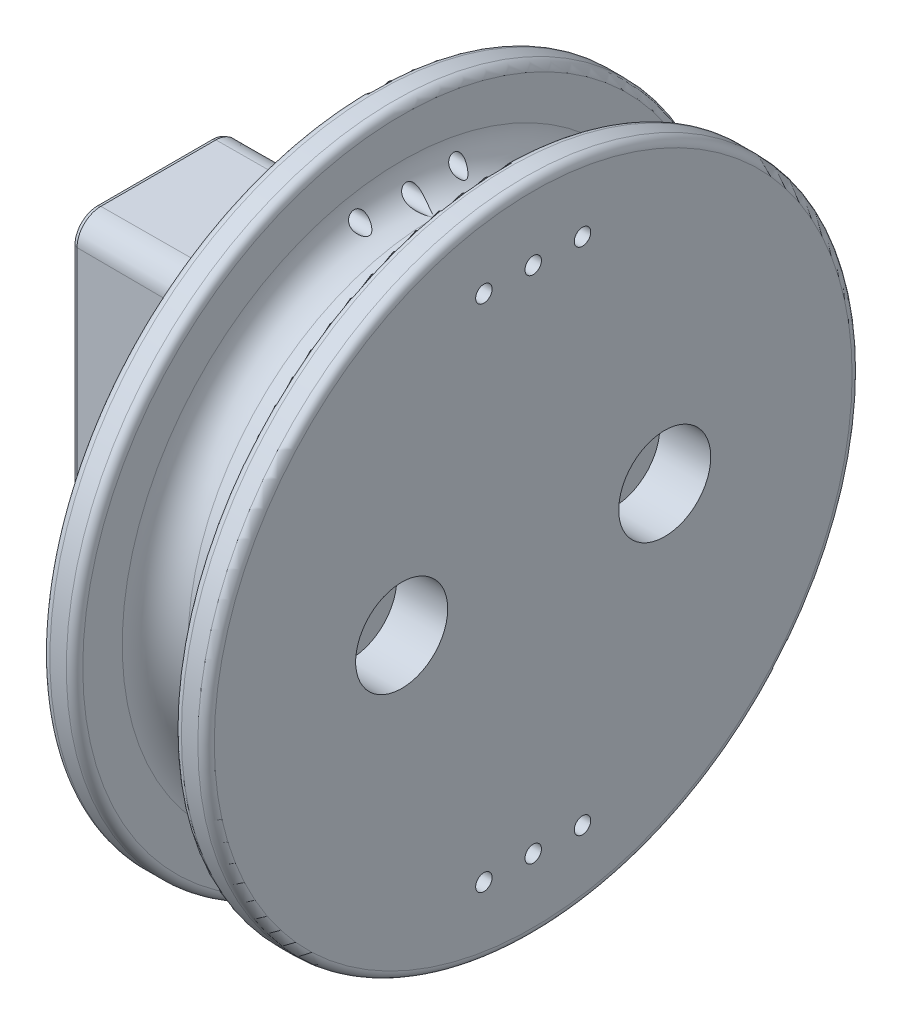
from build123d import *
from OCP.BRepFilletAPI import BRepFilletAPI_MakeChamfer

# Parameters (mm, degrees)
SKIZZE1_R                                            = 11.5
AUFSATZ_LINEAR_AUSTRAGEN1_DEPTH                      = 13
AUFSATZ_LINEAR_AUSTRAGEN2_DEPTH                      = 10
AUFSATZ_LINEAR_AUSTRAGEN2_DRAFT                      = -0.3
STIRNSENKUNG_F_R_M3_ZYLINDERSCHRAUBE_MIT_D           = 3.1
STIRNSENKUNG_F_R_M3_ZYLINDERSCHRAUBE_MIT_CBORE_D     = 5.6
STIRNSENKUNG_F_R_M3_ZYLINDERSCHRAUBE_MIT_CBORE_DEPTH = 3.1
SKIZZE6_R                                            = 19.9
SKIZZE6_R_2                                          = 11.5
AUFSATZ_LINEAR_AUSTRAGEN3_DEPTH                      = 10
VERRUNDUNG1_R                                        = 1
FASE2_SIZE                                           = 0.2
FASE2_SIZE2                                          = 0.07293404
SKIZZE8_W                                            = 6
SKIZZE8_H                                            = 4.9
VERRUNDUNG2_R                                        = 2
VERRUNDUNG3_R                                        = 0.5
VERRUNDUNG4_R                                        = 2
SCHNITT_LINEAR_START                                 = -10
SKIZZE10_R                                           = 0.5
SCHNITT_LINEAR_AUSTRAGEN4_DEPTH                      = 44.406885637


with BuildPart() as part:
    # Skizze1 → Aufsatz-Linear austragen1 (new body)
    with BuildSketch(Plane(origin=(0, 0, 0), x_dir=(0, 0, -1), z_dir=(1, 0, 0))):
        Circle(SKIZZE1_R)
    extrude(amount=AUFSATZ_LINEAR_AUSTRAGEN1_DEPTH)


with BuildPart() as aufsatz_linear_austragen2_tool:
    # Skizze2 → Aufsatz-Linear austragen2 (with draft: the straight prism first)
    with BuildSketch(Plane(origin=(0, 0, 0), x_dir=(0, 0, -1), z_dir=(1, 0, 0))):
        with BuildLine():
            Line((5, -7.5), (5, 7.5))
            ThreePointArc((5, 7.5), (4.560660172, 8.560660172), (3.5, 9))
            Line((3.5, 9), (-3.5, 9))
            ThreePointArc((-3.5, 9), (-4.560660172, 8.560660172), (-5, 7.5))
            Line((-5, 7.5), (-5, -7.5))
            ThreePointArc((-5, -7.5), (-4.560660172, -8.560660172), (-3.5, -9))
            Line((-3.5, -9), (3.5, -9))
            ThreePointArc((3.5, -9), (4.560660172, -8.560660172), (5, -7.5))
        make_face()
    extrude(amount=-AUFSATZ_LINEAR_AUSTRAGEN2_DEPTH)
    # Aufsatz-Linear austragen2: the draft: its side faces are tilted about the plane it starts from
    aufsatz_linear_austragen2_sides = [aufsatz_linear_austragen2_tool.faces().sort_by_distance(p)[0] for p in [
        (-5, 0, -5),
        (-5, 8.560660172, -4.560660172),
        (-5, 9, 0),
        (-5, 8.560660172, 4.560660172),
        (-5, 0, 5),
        (-5, -8.560660172, 4.560660172),
        (-5, -9, 0),
        (-5, -8.560660172, -4.560660172),
    ]]
    draft(aufsatz_linear_austragen2_sides, Plane(origin=(0, 0, 0), x_dir=(0, 0, -1), z_dir=(1, 0, 0)), AUFSATZ_LINEAR_AUSTRAGEN2_DRAFT)


with BuildPart() as part_1:
    add(part.part)

    # Aufsatz-Linear austragen2: add aufsatz_linear_austragen2_tool
    add(aufsatz_linear_austragen2_tool.part)

    # Stirnsenkung für M3 Zylinderschraube mit Innensechskant1 (through all)
    with Locations(Plane(origin=(13, 0, 0), x_dir=(0, 0, -1), z_dir=(1, 0, 0))):
        with Locations((8, 0), (-8, 0)):
            CounterBoreHole(STIRNSENKUNG_F_R_M3_ZYLINDERSCHRAUBE_MIT_D / 2, STIRNSENKUNG_F_R_M3_ZYLINDERSCHRAUBE_MIT_CBORE_D / 2, STIRNSENKUNG_F_R_M3_ZYLINDERSCHRAUBE_MIT_CBORE_DEPTH)

    # Skizze6 → Aufsatz-Linear austragen3 (add)
    with BuildSketch(Plane(origin=(3, 0, 0), x_dir=(0, 0, -1), z_dir=(1, 0, 0))):
        Circle(SKIZZE6_R)
        Circle(SKIZZE6_R_2, mode=Mode.SUBTRACT)
    extrude(amount=AUFSATZ_LINEAR_AUSTRAGEN3_DEPTH)

    # Verrundung1
    verrundung1_edges = [part_1.edges().sort_by_distance(p)[0] for p in [
        (0, -8.560660172, 4.560660172),
        (0, 0, 5),
        (0, 8.560660172, 4.560660172),
        (0, 9, 0),
        (0, 8.560660172, -4.560660172),
        (0, 0, -5),
        (0, -8.560660172, -4.560660172),
        (0, -9, 0),
    ]]
    fillet(verrundung1_edges, radius=VERRUNDUNG1_R)

    # Fase2: one chamfer whose edges measure the first distance from different faces: ONE call of the kernel's chamfer builder (chamfer() names one face for all edges)
    fase2_edges_1 = [part_1.edges().sort_by_distance(p)[0] for p in [
        (-10, 0, 4.947639644),
    ]]
    fase2_side_1 = [part_1.faces().sort_by_distance(p)[0] for p in [
        (-5.497382018, 0, 4.971215512),
    ]]
    fase2_edges_2 = [part_1.edges().sort_by_distance(p)[0] for p in [
        (-10, -8.523635809, 4.523635809),
    ]]
    fase2_side_2 = [part_1.faces().sort_by_distance(p)[0] for p in [
        (-5.497382018, -8.540306465, 4.540306465),
    ]]
    fase2_edges_3 = [part_1.edges().sort_by_distance(p)[0] for p in [
        (-10, 8.523635809, 4.523635809),
    ]]
    fase2_side_3 = [part_1.faces().sort_by_distance(p)[0] for p in [
        (-5.497382018, 8.540306465, 4.540306465),
    ]]
    fase2_edges_4 = [part_1.edges().sort_by_distance(p)[0] for p in [
        (-10, -8.947639644, 0),
    ]]
    fase2_side_4 = [part_1.faces().sort_by_distance(p)[0] for p in [
        (-5.497382018, -8.971215512, 0),
    ]]
    fase2_edges_5 = [part_1.edges().sort_by_distance(p)[0] for p in [
        (-10, 8.947639644, 0),
    ]]
    fase2_side_5 = [part_1.faces().sort_by_distance(p)[0] for p in [
        (-5.497382018, 8.971215512, 0),
    ]]
    fase2_edges_6 = [part_1.edges().sort_by_distance(p)[0] for p in [
        (-10, -8.523635809, -4.523635809),
    ]]
    fase2_side_6 = [part_1.faces().sort_by_distance(p)[0] for p in [
        (-5.497382018, -8.540306465, -4.540306465),
    ]]
    fase2_edges_7 = [part_1.edges().sort_by_distance(p)[0] for p in [
        (-10, 8.523635809, -4.523635809),
    ]]
    fase2_side_7 = [part_1.faces().sort_by_distance(p)[0] for p in [
        (-5.497382018, 8.540306465, -4.540306465),
    ]]
    fase2_edges_8 = [part_1.edges().sort_by_distance(p)[0] for p in [
        (-10, 0, -4.947639644),
    ]]
    fase2_side_8 = [part_1.faces().sort_by_distance(p)[0] for p in [
        (-5.497382018, 0, -4.971215512),
    ]]
    fase2 = BRepFilletAPI_MakeChamfer(part_1.part.solid().wrapped)
    for e in fase2_edges_1:
        fase2.Add(FASE2_SIZE, FASE2_SIZE2, e.wrapped, fase2_side_1[0].wrapped)  # the first distance lies on this face
    for e in fase2_edges_2:
        fase2.Add(FASE2_SIZE, FASE2_SIZE2, e.wrapped, fase2_side_2[0].wrapped)  # the first distance lies on this face
    for e in fase2_edges_3:
        fase2.Add(FASE2_SIZE, FASE2_SIZE2, e.wrapped, fase2_side_3[0].wrapped)  # the first distance lies on this face
    for e in fase2_edges_4:
        fase2.Add(FASE2_SIZE, FASE2_SIZE2, e.wrapped, fase2_side_4[0].wrapped)  # the first distance lies on this face
    for e in fase2_edges_5:
        fase2.Add(FASE2_SIZE, FASE2_SIZE2, e.wrapped, fase2_side_5[0].wrapped)  # the first distance lies on this face
    for e in fase2_edges_6:
        fase2.Add(FASE2_SIZE, FASE2_SIZE2, e.wrapped, fase2_side_6[0].wrapped)  # the first distance lies on this face
    for e in fase2_edges_7:
        fase2.Add(FASE2_SIZE, FASE2_SIZE2, e.wrapped, fase2_side_7[0].wrapped)  # the first distance lies on this face
    for e in fase2_edges_8:
        fase2.Add(FASE2_SIZE, FASE2_SIZE2, e.wrapped, fase2_side_8[0].wrapped)  # the first distance lies on this face
    add(Compound.cast(fase2.Shape()), mode=Mode.REPLACE)

    # Skizze8 → Schnitt-Rotation1 (revolve, cut)
    with BuildSketch(Plane(origin=(0, 0, 0), x_dir=(1, 0, 0), z_dir=(0, 1, 0))):
        with Locations((8, -17.45)):
            Rectangle(SKIZZE8_W, SKIZZE8_H)
    revolve(axis=Axis((11, 0, 0), (-1, 0, 0)), mode=Mode.SUBTRACT)

    # Verrundung2
    verrundung2_edges = [part_1.edges().sort_by_distance(p)[0] for p in [
        (11, 0, -15),
        (5, 0, -15),
    ]]
    fillet(verrundung2_edges, radius=VERRUNDUNG2_R)

    # Verrundung3
    verrundung3_edges = [part_1.edges().sort_by_distance(p)[0] for p in [
        (13, 0, 19.9),
        (11, 0, 19.9),
        (5, 0, 19.9),
        (3, 0, 19.9),
    ]]
    fillet(verrundung3_edges, radius=VERRUNDUNG3_R)

    # Verrundung4
    verrundung4_edges = [part_1.edges().sort_by_distance(p)[0] for p in [
        (3, 0, 11.5),
    ]]
    fillet(verrundung4_edges, radius=VERRUNDUNG4_R)

    # Skizze10 → Schnitt-Linear austragen4 (cut)
    with BuildSketch(Plane(origin=(8, 0, 0), x_dir=(0, 0, -1), z_dir=(1, 0, 0)).offset(SCHNITT_LINEAR_START)):
        with Locations((3, -15.5)):
            Circle(SKIZZE10_R)
        with Locations((-3, -15.5)):
            Circle(SKIZZE10_R)
        with Locations((0, -15.5)):
            Circle(SKIZZE10_R)
    schnitt_linear_austragen4 = extrude(amount=SCHNITT_LINEAR_AUSTRAGEN4_DEPTH, mode=Mode.SUBTRACT)

    # Spiegeln1: Schnitt-Linear austragen4 across plane
    add(schnitt_linear_austragen4.mirror(Plane.ZX), mode=Mode.SUBTRACT)


solid = part_1.part
